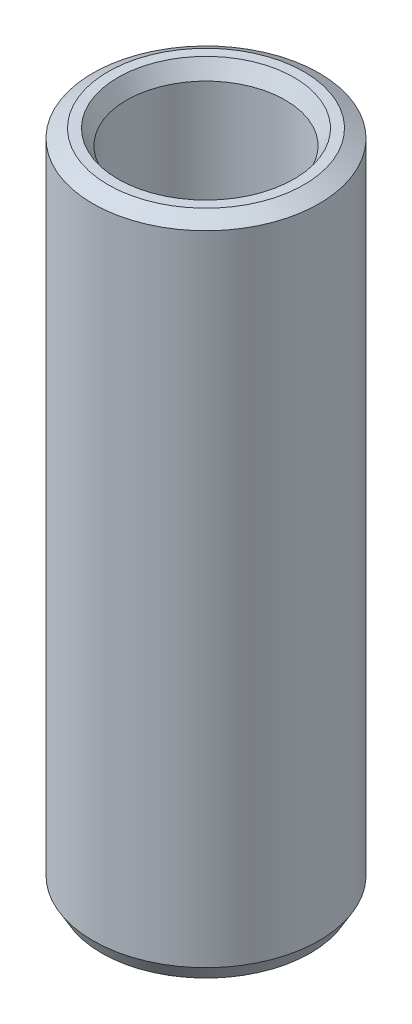
from build123d import *
from OCP.BRepFilletAPI import BRepFilletAPI_MakeChamfer

# Parameters (mm, degrees)
SKETCH1_R           = 50
BOSS_EXTRUDE1_DEPTH = 292.56596241
SKETCH2_R           = 35.025701575
CUT_EXTRUDE1_DEPTH  = 301.98977119
CHAMFER1_SIZE       = 3.880443959
CHAMFER1_SIZE2      = 6.721126093


with BuildPart() as part:
    # Sketch1 → Boss-Extrude1 (new body)
    with BuildSketch(Plane(origin=(0, 0, 0), x_dir=(1, 0, 0), z_dir=(0, 1, 0))):
        Circle(SKETCH1_R)
    extrude(amount=BOSS_EXTRUDE1_DEPTH)

    # Sketch2 → Cut-Extrude1 (cut, through all)
    with BuildSketch(Plane(origin=(0, 0, 0), x_dir=(1, 0, 0), z_dir=(0, 1, 0))):
        Circle(SKETCH2_R)
    extrude(amount=CUT_EXTRUDE1_DEPTH, mode=Mode.SUBTRACT)

    # Chamfer1: one chamfer whose edges measure the first distance from different faces: ONE call of the kernel's chamfer builder (chamfer() names one face for all edges)
    chamfer1_edges_1 = [part.edges().sort_by_distance(p)[0] for p in [
        (-35.025701575, 292.56596241, 0),
    ]]
    chamfer1_side_1 = [part.faces().sort_by_distance(p)[0] for p in [
        (-48.585786438, 292.56596241, 0),
    ]]
    chamfer1_edges_2 = [part.edges().sort_by_distance(p)[0] for p in [
        (-35.025701575, 0, 0),
    ]]
    chamfer1_side_2 = [part.faces().sort_by_distance(p)[0] for p in [
        (-35.025701575, 146.282981205, 0),
    ]]
    chamfer1_edges_3 = [part.edges().sort_by_distance(p)[0] for p in [
        (-50, 0, 0),
    ]]
    chamfer1_side_3 = [part.faces().sort_by_distance(p)[0] for p in [
        (-48.585786438, 0, 0),
    ]]
    chamfer1_edges_4 = [part.edges().sort_by_distance(p)[0] for p in [
        (-50, 292.56596241, 0),
    ]]
    chamfer1_side_4 = [part.faces().sort_by_distance(p)[0] for p in [
        (-50, 146.282981205, 0),
    ]]
    chamfer1 = BRepFilletAPI_MakeChamfer(part.part.solid().wrapped)
    for e in chamfer1_edges_1:
        chamfer1.Add(CHAMFER1_SIZE, CHAMFER1_SIZE2, e.wrapped, chamfer1_side_1[0].wrapped)  # the first distance lies on this face
    for e in chamfer1_edges_2:
        chamfer1.Add(CHAMFER1_SIZE, CHAMFER1_SIZE2, e.wrapped, chamfer1_side_2[0].wrapped)  # the first distance lies on this face
    for e in chamfer1_edges_3:
        chamfer1.Add(CHAMFER1_SIZE, CHAMFER1_SIZE2, e.wrapped, chamfer1_side_3[0].wrapped)  # the first distance lies on this face
    for e in chamfer1_edges_4:
        chamfer1.Add(CHAMFER1_SIZE, CHAMFER1_SIZE2, e.wrapped, chamfer1_side_4[0].wrapped)  # the first distance lies on this face
    add(Compound.cast(chamfer1.Shape()), mode=Mode.REPLACE)


solid = part.part
